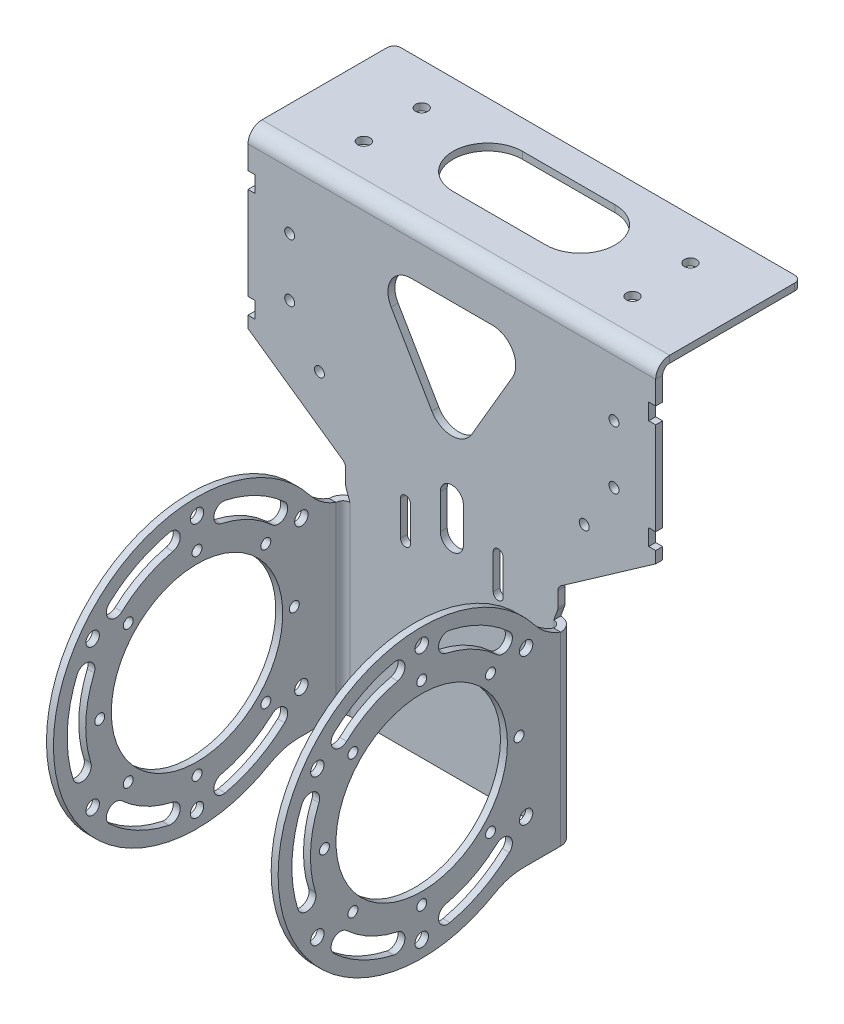
from build123d import *

# Parameters (mm, degrees)
BASE_FLANGE1_START       = -3
BASE_FLANGE1_OUTLINE_R   = 1
BASE_FLANGE1_DEPTH       = 3
EDGE_FLANGE1_DEPTH       = 80
EDGE_FLANGE1_START       = 3
EDGE_FLANGE1_PROFILE_R   = 1
EDGE_FLANGE1_PROFILE_R_2 = 37
EDGE_FLANGE1_FLAT_DEPTH  = 3
FILLET2_START            = -50
FILLET2_DEPTH            = 3
F_6_0MM_DOWEL_HOLE1_D    = 5.8
M4_CLEARANCE_HOLE1_D     = 4.3
EDGE_FLANGE2_DEPTH       = 176
EDGE_FLANGE2_START       = 3
EDGE_FLANGE2_PROFILE_W   = 176
EDGE_FLANGE2_PROFILE_H   = 57
EDGE_FLANGE2_PROFILE_R   = 1
EDGE_FLANGE2_FLAT_DEPTH  = 3
FILLET1_R                = 3
FILLET3_R                = 3
M4_CLEARANCE_HOLE2_D     = 4.3
M4_CLEARANCE_HOLE2_DEPTH = 7.5
M4_CLEARANCE_HOLE2_TIP   = 1.291850331
M5_CLEARANCE_HOLE1_D     = 5.3


with BuildPart() as part:
    # Base-Flange1: read off the stored shape, not the designer's step
    # Base-Flange1 outline → Base-Flange1 (new body)
    with BuildSketch(Plane.XY.offset(BASE_FLANGE1_START)):
        Polygon((88, 128), (85, 128), (85, 135), (88, 135), (88, 175), (85, 175), (85, 182), (88, 182), (88, 192), (-88, 192), (-88, 182), (-85, 182), (-85, 175), (-88, 175), (-88, 135), (-85, 135), (-85, 128), (-88, 128), (-88, 123), (-45.819851171, 93.465141827), (-45.819851171, 85), (-44, 80), (-44, 0), (44, 0), (44, 80), (45.819851171, 85), (45.819851171, 93.465141827), (88, 123), align=None)
        with BuildLine():
            ThreePointArc((-17.85, 77.5), (-20, 75.35), (-22.15, 77.5))
            Line((-22.15, 77.5), (-22.15, 92.5))
            ThreePointArc((-22.15, 92.5), (-20, 94.65), (-17.85, 92.5))
            Line((-17.85, 92.5), (-17.85, 77.5))
        make_face(mode=Mode.SUBTRACT)
        with BuildLine():
            ThreePointArc((22.15, 77.5), (20, 75.35), (17.85, 77.5))
            Line((17.85, 77.5), (17.85, 92.5))
            ThreePointArc((17.85, 92.5), (20, 94.65), (22.15, 92.5))
            Line((22.15, 92.5), (22.15, 77.5))
        make_face(mode=Mode.SUBTRACT)
        with Locations((-70, 142.5)):
            Circle(BASE_FLANGE1_OUTLINE_R, mode=Mode.SUBTRACT)
        with Locations((-57.147, 122.2473268)):
            Circle(BASE_FLANGE1_OUTLINE_R, mode=Mode.SUBTRACT)
        with Locations((-70, 167.5)):
            Circle(BASE_FLANGE1_OUTLINE_R, mode=Mode.SUBTRACT)
        with BuildLine():
            ThreePointArc((-5, 103.5), (0, 108.5), (5, 103.5))
            Line((5, 103.5), (5, 88.5))
            ThreePointArc((5, 88.5), (0, 83.5), (-5, 88.5))
            Line((-5, 88.5), (-5, 103.5))
        make_face(mode=Mode.SUBTRACT)
        with Locations((57.147, 122.2473268)):
            Circle(BASE_FLANGE1_OUTLINE_R, mode=Mode.SUBTRACT)
        with Locations((70, 142.5)):
            Circle(BASE_FLANGE1_OUTLINE_R, mode=Mode.SUBTRACT)
        with BuildLine():
            ThreePointArc((17.589630009, 177), (26.261051534, 171.980607264), (26.227419018, 161.961289745))
            Line((26.227419018, 161.961289745), (8.637789009, 131.807638301))
            ThreePointArc((8.637789009, 131.807638301), (0, 126.846348556), (-8.637789009, 131.807638301))
            Line((-8.637789009, 131.807638301), (-26.227419018, 161.961289745))
            ThreePointArc((-26.227419018, 161.961289745), (-26.261051534, 171.980607264), (-17.589630009, 177))
            Line((-17.589630009, 177), (17.589630009, 177))
        make_face(mode=Mode.SUBTRACT)
        with Locations((70, 167.5)):
            Circle(BASE_FLANGE1_OUTLINE_R, mode=Mode.SUBTRACT)
    extrude(amount=BASE_FLANGE1_DEPTH)

    # Edge-Flange1: sheet metal written as solids
    # Edge-Flange1 bend section (on a plane across the edge) → Edge-Flange1 (add)
    with BuildSketch(Plane(origin=(-47, 80, 0), x_dir=(1, 0, 0), z_dir=(0, -1, 0))):
        with BuildLine():
            Line((-3, 3), (0, 3))
            ThreePointArc((0, 3), (0.878679656, 0.878679656), (3, 0))
            Line((3, 0), (3, -3))
            ThreePointArc((3, -3), (-1.242640687, -1.242640687), (-3, 3))
        make_face()
    edge_flange1 = extrude(amount=EDGE_FLANGE1_DEPTH)

    # Edge-Flange1 profile (on flange) → Edge-Flange1 flat (add)
    with BuildSketch(Plane(origin=(-47, 0, 0), x_dir=(0, -1, 0), z_dir=(-1, 0, 0)).offset(EDGE_FLANGE1_START)):
        with BuildLine():
            ThreePointArc((0, 26.33939444), (-63.320011368, 123.552269133), (-80, 8.741360135))
            Line((-80, 8.741360135), (-80, 3))
            Line((-80, 3), (0, 3))
            Line((0, 3), (0, 26.33939444))
        make_face()
        with Locations((-18.453296001, 17.946637564)):
            Circle(EDGE_FLANGE1_PROFILE_R, mode=Mode.SUBTRACT)
        with BuildLine():
            ThreePointArc((-8.712469139, 25.166948374), (-14.363939316, 24.920199857), (-14.610687833, 30.571670034))
            ThreePointArc((-14.610687833, 30.571670034), (-7.423480007, 40.836066565), (-3.137791658, 52.610898531))
            ThreePointArc((-3.137791658, 52.610898531), (1.633150826, 55.650324104), (4.672576399, 50.879381619))
            ThreePointArc((4.672576399, 50.879381619), (-0.327393342, 37.142077659), (-8.712469139, 25.166948374))
        make_face(mode=Mode.SUBTRACT)
        with Locations((-20.30151519, 33.30151519)):
            Circle(EDGE_FLANGE1_PROFILE_R, mode=Mode.SUBTRACT)
        with Locations((-50, 21)):
            Circle(EDGE_FLANGE1_PROFILE_R, mode=Mode.SUBTRACT)
        with Locations((5, 63)):
            Circle(EDGE_FLANGE1_PROFILE_R, mode=Mode.SUBTRACT)
        with Locations((-8, 63)):
            Circle(EDGE_FLANGE1_PROFILE_R, mode=Mode.SUBTRACT)
        with Locations((-50, 63)):
            Circle(EDGE_FLANGE1_PROFILE_R_2, mode=Mode.SUBTRACT)
        with Locations((-81.546703999, 17.946637564)):
            Circle(EDGE_FLANGE1_PROFILE_R, mode=Mode.SUBTRACT)
        with Locations((-79.69848481, 33.30151519)):
            Circle(EDGE_FLANGE1_PROFILE_R, mode=Mode.SUBTRACT)
        with BuildLine():
            ThreePointArc((-85.389312167, 30.571670034), (-85.636060684, 24.920199857), (-91.287530861, 25.166948374))
            ThreePointArc((-91.287530861, 25.166948374), (-99.672606658, 37.142077659), (-104.672576399, 50.879381619))
            ThreePointArc((-104.672576399, 50.879381619), (-101.633150826, 55.650324104), (-96.862208342, 52.610898531))
            ThreePointArc((-96.862208342, 52.610898531), (-92.576519993, 40.836066565), (-85.389312167, 30.571670034))
        make_face(mode=Mode.SUBTRACT)
        with Locations((-92, 63)):
            Circle(EDGE_FLANGE1_PROFILE_R, mode=Mode.SUBTRACT)
        with Locations((-105, 63)):
            Circle(EDGE_FLANGE1_PROFILE_R, mode=Mode.SUBTRACT)
        with BuildLine():
            ThreePointArc((-14.610687833, 95.428329966), (-14.363939316, 101.079800143), (-8.712469139, 100.833051626))
            ThreePointArc((-8.712469139, 100.833051626), (-0.327393342, 88.857922341), (4.672576399, 75.120618381))
            ThreePointArc((4.672576399, 75.120618381), (1.633150826, 70.349675896), (-3.137791658, 73.389101469))
            ThreePointArc((-3.137791658, 73.389101469), (-7.423480007, 85.163933435), (-14.610687833, 95.428329966))
        make_face(mode=Mode.SUBTRACT)
        with Locations((-20.30151519, 92.69848481)):
            Circle(EDGE_FLANGE1_PROFILE_R, mode=Mode.SUBTRACT)
        with Locations((-18.453296001, 108.053362436)):
            Circle(EDGE_FLANGE1_PROFILE_R, mode=Mode.SUBTRACT)
        with Locations((-50, 105)):
            Circle(EDGE_FLANGE1_PROFILE_R, mode=Mode.SUBTRACT)
        with Locations((-79.69848481, 92.69848481)):
            Circle(EDGE_FLANGE1_PROFILE_R, mode=Mode.SUBTRACT)
        with BuildLine():
            ThreePointArc((-91.287530861, 100.833051626), (-85.636060684, 101.079800143), (-85.389312167, 95.428329966))
            ThreePointArc((-85.389312167, 95.428329966), (-92.576519993, 85.163933435), (-96.862208342, 73.389101469))
            ThreePointArc((-96.862208342, 73.389101469), (-101.633150826, 70.349675896), (-104.672576399, 75.120618381))
            ThreePointArc((-104.672576399, 75.120618381), (-99.672606658, 88.857922341), (-91.287530861, 100.833051626))
        make_face(mode=Mode.SUBTRACT)
        with BuildLine():
            ThreePointArc((-33.145578374, 116.455396025), (-30.533533769, 111.437705024), (-35.55122477, 108.825660419))
            ThreePointArc((-35.55122477, 108.825660419), (-52.095891482, 111.003807114), (-68.387762749, 107.391986209))
            ThreePointArc((-68.387762749, 107.391986209), (-73.614014608, 109.55677061), (-71.449230208, 114.783022469))
            ThreePointArc((-71.449230208, 114.783022469), (-52.444846581, 118.996192886), (-33.145578374, 116.455396025))
        make_face(mode=Mode.SUBTRACT)
        with Locations((-81.546703999, 108.053362436)):
            Circle(EDGE_FLANGE1_PROFILE_R, mode=Mode.SUBTRACT)
    edge_flange1_flat = extrude(amount=-EDGE_FLANGE1_FLAT_DEPTH)

    # Fillet2: read off the stored shape, not the designer's step
    # Fillet2 outline → Fillet2 (add)
    with BuildSketch(Plane.YZ.offset(FILLET2_START)):
        with BuildLine():
            ThreePointArc((80, 3), (83.273291285, 9.110279884), (88.098608392, 14.086852089))
            ThreePointArc((88.098608392, 14.086852089), (84.154043498, 11.255422384), (80, 8.741360135))
            Line((80, 8.741360135), (80, 3))
        make_face()
        with BuildLine():
            ThreePointArc((-3.448275862, 31.578959162), (-0.877467966, 25.474506273), (0, 18.90918463))
            Line((0, 18.90918463), (0, 26.33939444))
            ThreePointArc((0, 26.33939444), (-1.79044028, 28.915541728), (-3.448275862, 31.578959162))
        make_face()
    fillet2 = extrude(amount=FILLET2_DEPTH)

    # Ø6.0mm Dowel Hole1 (through all)
    with Locations(Plane.ZY.offset(50)):
        with Locations((63, 105), (108.053362436, 81.546703999), (17.946637564, 81.546703999), (17.946637564, 18.453296001), (63, -5), (108.053362436, 18.453296001)):
            f_6_0mm_dowel_hole1 = Hole(F_6_0MM_DOWEL_HOLE1_D / 2)

    # M4 Clearance Hole1 (through all)
    with Locations(Plane.ZY.offset(50)):
        with Locations((63, 92), (92.69848481, 79.69848481), (105, 50), (63, 8), (33.30151519, 20.30151519), (21, 50), (33.30151519, 79.69848481), (92.69848481, 20.30151519)):
            m4_clearance_hole1 = Hole(M4_CLEARANCE_HOLE1_D / 2)

    # Mirror1: Edge-Flange1, Edge-Flange1 flat, Fillet2, Ø6.0mm Dowel Hole1, M4 Clearance Hole1 across plane
    add(edge_flange1.mirror(Plane(origin=(0, 0, 0), x_dir=(0, 0, 1), z_dir=(1, 0, 0))))
    add(edge_flange1_flat.mirror(Plane(origin=(0, 0, 0), x_dir=(0, 0, 1), z_dir=(1, 0, 0))))
    add(fillet2.mirror(Plane(origin=(0, 0, 0), x_dir=(0, 0, 1), z_dir=(1, 0, 0))))
    add(f_6_0mm_dowel_hole1.mirror(Plane(origin=(0, 0, 0), x_dir=(0, 0, 1), z_dir=(1, 0, 0))), mode=Mode.SUBTRACT)
    add(m4_clearance_hole1.mirror(Plane(origin=(0, 0, 0), x_dir=(0, 0, 1), z_dir=(1, 0, 0))), mode=Mode.SUBTRACT)

    # Edge-Flange2: sheet metal written as solids
    # Edge-Flange2 bend section (on a plane across the edge) → Edge-Flange2 (add)
    with BuildSketch(Plane(origin=(-88, 195, -3), x_dir=(0, -1, 0), z_dir=(1, 0, 0))):
        with BuildLine():
            Line((-3, 3), (0, 3))
            ThreePointArc((0, 3), (0.878679656, 0.878679656), (3, 0))
            Line((3, 0), (3, -3))
            ThreePointArc((3, -3), (-1.242640687, -1.242640687), (-3, 3))
        make_face()
    extrude(amount=EDGE_FLANGE2_DEPTH)

    # Edge-Flange2 profile (on flange) → Edge-Flange2 flat (add)
    with BuildSketch(Plane(origin=(0, 195, -3), x_dir=(1, 0, 0), z_dir=(0, 1, 0)).offset(EDGE_FLANGE2_START)):
        with Locations((0, 31.5)):
            Rectangle(EDGE_FLANGE2_PROFILE_W, EDGE_FLANGE2_PROFILE_H)
        with Locations((58, 17)):
            Circle(EDGE_FLANGE2_PROFILE_R, mode=Mode.SUBTRACT)
        with Locations((-58, 17)):
            Circle(EDGE_FLANGE2_PROFILE_R, mode=Mode.SUBTRACT)
        with Locations((58, 42)):
            Circle(EDGE_FLANGE2_PROFILE_R, mode=Mode.SUBTRACT)
        with BuildLine():
            Line((20, 17.5), (-20, 17.5))
            ThreePointArc((-20, 17.5), (-35, 32.5), (-20, 47.5))
            Line((-20, 47.5), (20, 47.5))
            ThreePointArc((20, 47.5), (35, 32.5), (20, 17.5))
        make_face(mode=Mode.SUBTRACT)
        with Locations((-58, 42)):
            Circle(EDGE_FLANGE2_PROFILE_R, mode=Mode.SUBTRACT)
    extrude(amount=-EDGE_FLANGE2_FLAT_DEPTH)

    # Fillet1
    fillet1_edges = [part.edges().sort_by_distance(p)[0] for p in [
        (-88, 196.5, -63),
        (88, 196.5, -63),
    ]]
    fillet(fillet1_edges, radius=FILLET1_R)

    # Fillet3
    fillet3_edges = [part.edges().sort_by_distance(p)[0] for p in [
        (-45.819851171, 93.465141827, -1.5),
        (-45.819851171, 85, -1.5),
        (45.819851171, 85, -1.5),
        (45.819851171, 93.465141827, -1.5),
    ]]
    fillet(fillet3_edges, radius=FILLET3_R)

    # M4 Clearance Hole2
    with Locations(Plane(origin=(0, 0, -3), x_dir=(-1, 0, 0), z_dir=(0, 0, -1))):
        with Locations((-70, 167.5), (-70, 142.5), (70, 167.5), (70, 142.5), (57.147, 122.2473268), (-57.147, 122.2473268)):
            Hole(M4_CLEARANCE_HOLE2_D / 2, depth=M4_CLEARANCE_HOLE2_DEPTH)
            with Locations((0, 0, -(M4_CLEARANCE_HOLE2_DEPTH + M4_CLEARANCE_HOLE2_TIP / 2))):  # 118° drill point
                Cone(0, M4_CLEARANCE_HOLE2_D / 2, M4_CLEARANCE_HOLE2_TIP, mode=Mode.SUBTRACT)

    # M5 Clearance Hole1 (through all)
    with Locations(Plane(origin=(0, 198, 0), x_dir=(1, 0, 0), z_dir=(0, 1, 0))):
        with Locations((-58, 20), (-58, 45), (58, 45), (58, 20)):
            Hole(M5_CLEARANCE_HOLE1_D / 2)


solid = part.part
